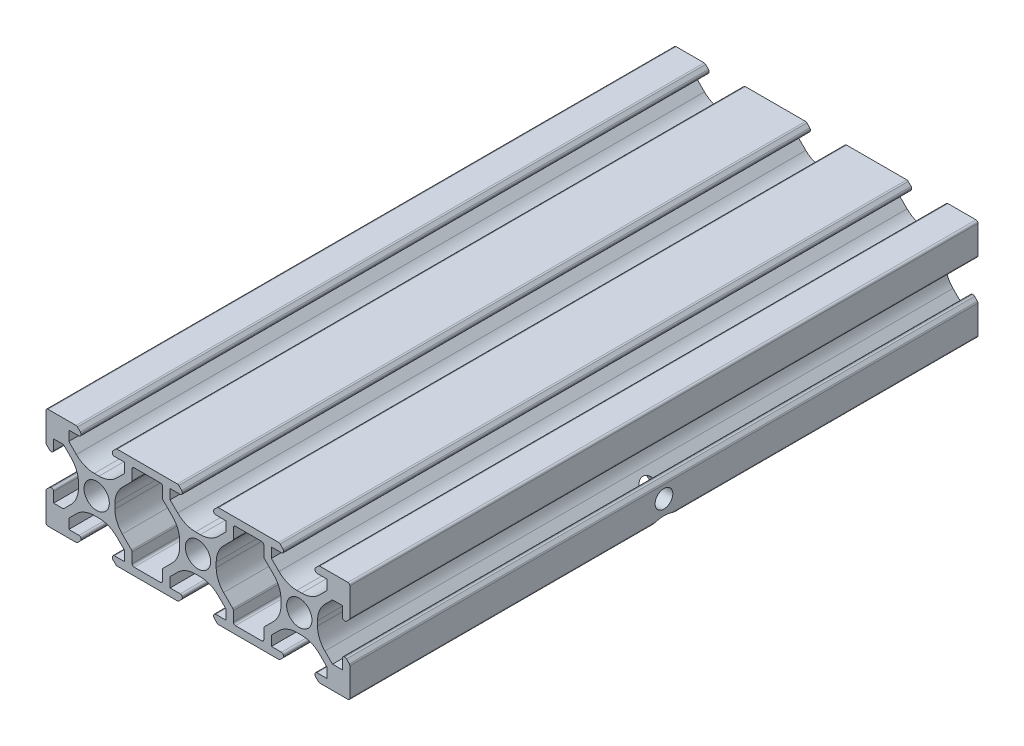
from build123d import *

# Parameters (mm, degrees)
RESSALTO_EXTRUS_O1_DEPTH    = 124
PADR_OCIRCULAR1_COUNT       = 4
PADR_O_LINEAR1_COUNT        = 3
PADR_O_LINEAR1_PITCH        = 20
PADR_O_LINEAR1_COPY_1_DEPTH = 124
PADR_O_LINEAR1_COPY_2_DEPTH = 124
PADR_O_LINEAR1_COPY_3_DEPTH = 124
PADR_O_LINEAR1_COPY_4_DEPTH = 124
PADR_O_LINEAR1_COPY_5_DEPTH = 124
PADR_O_LINEAR1_COPY_6_DEPTH = 124
CORTE_EXTRUS_O1_DEPTH       = 135.074606097
PADR_O_LINEAR2_COUNT        = 2
PADR_O_LINEAR2_PITCH        = 20
FILETE1_R                   = 0.4
FILETE2_R                   = 0.4
SKETCH2_R                   = 5.1
CUT_EXTRUDE2_DEPTH          = 139.115893365
SKETCH3_R                   = 1.75
CUT_EXTRUDE3_DEPTH          = 139.115893505


with BuildPart() as part:
    # Esboço1 → Ressalto-extrusão1 (new body)
    with BuildSketch(Plane.XY):
        with BuildLine():
            ThreePointArc((-9.317157288, 3.217157288), (-9.187387948, 3.130448187), (-9.034314575, 3.1))
            Line((-9.034314575, 3.1), (-8.9, 3.1))
            ThreePointArc((-8.9, 3.1), (-8.617157288, 3.217157288), (-8.5, 3.5))
            Line((-8.5, 3.5), (-8.5, 5.5))
            Line((-8.5, 5.5), (-6.560660172, 5.5))
            Line((-6.560660172, 5.5), (-5.064466094, 4.003805922))
            ThreePointArc((-5.064466094, 4.003805922), (-3.980602337, 2.381689178), (-3.6, 0.468272016))
            Line((-3.6, 0.468272016), (-3.6, 0))
            Line((-3.6, 0), (-2.5, 0))
            ThreePointArc((-2.5, 0), (-1.767766953, 1.767766953), (0, 2.5))
            Line((0, 2.5), (0, 3.6))
            Line((0, 3.6), (-0.468272016, 3.6))
            ThreePointArc((-0.468272016, 3.6), (-2.381689178, 3.980602337), (-4.003805922, 5.064466094))
            Line((-4.003805922, 5.064466094), (-5.5, 6.560660172))
            Line((-5.5, 6.560660172), (-5.5, 8.5))
            Line((-5.5, 8.5), (-3.5, 8.5))
            ThreePointArc((-3.5, 8.5), (-3.217157288, 8.617157288), (-3.1, 8.9))
            Line((-3.1, 8.9), (-3.1, 9.034314575))
            ThreePointArc((-3.1, 9.034314575), (-3.130448187, 9.187387948), (-3.217157288, 9.317157288))
            Line((-3.217157288, 9.317157288), (-3.782842712, 9.882842712))
            ThreePointArc((-3.782842712, 9.882842712), (-3.912612052, 9.969551813), (-4.065685425, 10))
            Line((-4.065685425, 10), (-10, 10))
            Line((-10, 10), (-10, 4.065685425))
            ThreePointArc((-10, 4.065685425), (-9.969551813, 3.912612052), (-9.882842712, 3.782842712))
            Line((-9.882842712, 3.782842712), (-9.317157288, 3.217157288))
        make_face()
    ressalto_extrus_o1 = extrude(amount=RESSALTO_EXTRUS_O1_DEPTH)

    # PadrãoCircular1: Ressalto-extrusão1 ×4 about axis
    padr_ocircular1_axis = Axis((0, 0, 0), (0, 0, 1))
    for i in range(1, PADR_OCIRCULAR1_COUNT):
        add(ressalto_extrus_o1.rotate(padr_ocircular1_axis, i * 360 / PADR_OCIRCULAR1_COUNT))

    # Padrão linear1: Ressalto-extrusão1 ×3
    with Locations(*[(i * PADR_O_LINEAR1_PITCH, 0, 0) for i in range(1, PADR_O_LINEAR1_COUNT)]):
        add(ressalto_extrus_o1)

    # Padrão linear1 copy 1 sketch → Padrão linear1 copy 1 (add)
    with BuildSketch(Plane(origin=(20, 0, 0), x_dir=(0, 1, 0), z_dir=(0, 0, 1))):
        with BuildLine():
            ThreePointArc((-9.317157288, 3.217157288), (-9.187387948, 3.130448187), (-9.034314575, 3.1))
            Line((-9.034314575, 3.1), (-8.9, 3.1))
            ThreePointArc((-8.9, 3.1), (-8.617157288, 3.217157288), (-8.5, 3.5))
            Line((-8.5, 3.5), (-8.5, 5.5))
            Line((-8.5, 5.5), (-6.560660172, 5.5))
            Line((-6.560660172, 5.5), (-5.064466094, 4.003805922))
            ThreePointArc((-5.064466094, 4.003805922), (-3.980602337, 2.381689178), (-3.6, 0.468272016))
            Line((-3.6, 0.468272016), (-3.6, 0))
            Line((-3.6, 0), (-2.5, 0))
            ThreePointArc((-2.5, 0), (-1.767766953, 1.767766953), (0, 2.5))
            Line((0, 2.5), (0, 3.6))
            Line((0, 3.6), (-0.468272016, 3.6))
            ThreePointArc((-0.468272016, 3.6), (-2.381689178, 3.980602337), (-4.003805922, 5.064466094))
            Line((-4.003805922, 5.064466094), (-5.5, 6.560660172))
            Line((-5.5, 6.560660172), (-5.5, 8.5))
            Line((-5.5, 8.5), (-3.5, 8.5))
            ThreePointArc((-3.5, 8.5), (-3.217157288, 8.617157288), (-3.1, 8.9))
            Line((-3.1, 8.9), (-3.1, 9.034314575))
            ThreePointArc((-3.1, 9.034314575), (-3.130448187, 9.187387948), (-3.217157288, 9.317157288))
            Line((-3.217157288, 9.317157288), (-3.782842712, 9.882842712))
            ThreePointArc((-3.782842712, 9.882842712), (-3.912612052, 9.969551813), (-4.065685425, 10))
            Line((-4.065685425, 10), (-10, 10))
            Line((-10, 10), (-10, 4.065685425))
            ThreePointArc((-10, 4.065685425), (-9.969551813, 3.912612052), (-9.882842712, 3.782842712))
            Line((-9.882842712, 3.782842712), (-9.317157288, 3.217157288))
        make_face()
    extrude(amount=PADR_O_LINEAR1_COPY_1_DEPTH)

    # Padrão linear1 copy 2 sketch → Padrão linear1 copy 2 (add)
    with BuildSketch(Plane(origin=(40, 0, 0), x_dir=(0, 1, 0), z_dir=(0, 0, 1))):
        with BuildLine():
            ThreePointArc((-9.317157288, 3.217157288), (-9.187387948, 3.130448187), (-9.034314575, 3.1))
            Line((-9.034314575, 3.1), (-8.9, 3.1))
            ThreePointArc((-8.9, 3.1), (-8.617157288, 3.217157288), (-8.5, 3.5))
            Line((-8.5, 3.5), (-8.5, 5.5))
            Line((-8.5, 5.5), (-6.560660172, 5.5))
            Line((-6.560660172, 5.5), (-5.064466094, 4.003805922))
            ThreePointArc((-5.064466094, 4.003805922), (-3.980602337, 2.381689178), (-3.6, 0.468272016))
            Line((-3.6, 0.468272016), (-3.6, 0))
            Line((-3.6, 0), (-2.5, 0))
            ThreePointArc((-2.5, 0), (-1.767766953, 1.767766953), (0, 2.5))
            Line((0, 2.5), (0, 3.6))
            Line((0, 3.6), (-0.468272016, 3.6))
            ThreePointArc((-0.468272016, 3.6), (-2.381689178, 3.980602337), (-4.003805922, 5.064466094))
            Line((-4.003805922, 5.064466094), (-5.5, 6.560660172))
            Line((-5.5, 6.560660172), (-5.5, 8.5))
            Line((-5.5, 8.5), (-3.5, 8.5))
            ThreePointArc((-3.5, 8.5), (-3.217157288, 8.617157288), (-3.1, 8.9))
            Line((-3.1, 8.9), (-3.1, 9.034314575))
            ThreePointArc((-3.1, 9.034314575), (-3.130448187, 9.187387948), (-3.217157288, 9.317157288))
            Line((-3.217157288, 9.317157288), (-3.782842712, 9.882842712))
            ThreePointArc((-3.782842712, 9.882842712), (-3.912612052, 9.969551813), (-4.065685425, 10))
            Line((-4.065685425, 10), (-10, 10))
            Line((-10, 10), (-10, 4.065685425))
            ThreePointArc((-10, 4.065685425), (-9.969551813, 3.912612052), (-9.882842712, 3.782842712))
            Line((-9.882842712, 3.782842712), (-9.317157288, 3.217157288))
        make_face()
    extrude(amount=PADR_O_LINEAR1_COPY_2_DEPTH)

    # Padrão linear1 copy 3 sketch → Padrão linear1 copy 3 (add)
    with BuildSketch(Plane(origin=(20, 0, 0), x_dir=(-1, 0, 0), z_dir=(0, 0, 1))):
        with BuildLine():
            ThreePointArc((-9.317157288, 3.217157288), (-9.187387948, 3.130448187), (-9.034314575, 3.1))
            Line((-9.034314575, 3.1), (-8.9, 3.1))
            ThreePointArc((-8.9, 3.1), (-8.617157288, 3.217157288), (-8.5, 3.5))
            Line((-8.5, 3.5), (-8.5, 5.5))
            Line((-8.5, 5.5), (-6.560660172, 5.5))
            Line((-6.560660172, 5.5), (-5.064466094, 4.003805922))
            ThreePointArc((-5.064466094, 4.003805922), (-3.980602337, 2.381689178), (-3.6, 0.468272016))
            Line((-3.6, 0.468272016), (-3.6, 0))
            Line((-3.6, 0), (-2.5, 0))
            ThreePointArc((-2.5, 0), (-1.767766953, 1.767766953), (0, 2.5))
            Line((0, 2.5), (0, 3.6))
            Line((0, 3.6), (-0.468272016, 3.6))
            ThreePointArc((-0.468272016, 3.6), (-2.381689178, 3.980602337), (-4.003805922, 5.064466094))
            Line((-4.003805922, 5.064466094), (-5.5, 6.560660172))
            Line((-5.5, 6.560660172), (-5.5, 8.5))
            Line((-5.5, 8.5), (-3.5, 8.5))
            ThreePointArc((-3.5, 8.5), (-3.217157288, 8.617157288), (-3.1, 8.9))
            Line((-3.1, 8.9), (-3.1, 9.034314575))
            ThreePointArc((-3.1, 9.034314575), (-3.130448187, 9.187387948), (-3.217157288, 9.317157288))
            Line((-3.217157288, 9.317157288), (-3.782842712, 9.882842712))
            ThreePointArc((-3.782842712, 9.882842712), (-3.912612052, 9.969551813), (-4.065685425, 10))
            Line((-4.065685425, 10), (-10, 10))
            Line((-10, 10), (-10, 4.065685425))
            ThreePointArc((-10, 4.065685425), (-9.969551813, 3.912612052), (-9.882842712, 3.782842712))
            Line((-9.882842712, 3.782842712), (-9.317157288, 3.217157288))
        make_face()
    extrude(amount=PADR_O_LINEAR1_COPY_3_DEPTH)

    # Padrão linear1 copy 4 sketch → Padrão linear1 copy 4 (add)
    with BuildSketch(Plane(origin=(40, 0, 0), x_dir=(-1, 0, 0), z_dir=(0, 0, 1))):
        with BuildLine():
            ThreePointArc((-9.317157288, 3.217157288), (-9.187387948, 3.130448187), (-9.034314575, 3.1))
            Line((-9.034314575, 3.1), (-8.9, 3.1))
            ThreePointArc((-8.9, 3.1), (-8.617157288, 3.217157288), (-8.5, 3.5))
            Line((-8.5, 3.5), (-8.5, 5.5))
            Line((-8.5, 5.5), (-6.560660172, 5.5))
            Line((-6.560660172, 5.5), (-5.064466094, 4.003805922))
            ThreePointArc((-5.064466094, 4.003805922), (-3.980602337, 2.381689178), (-3.6, 0.468272016))
            Line((-3.6, 0.468272016), (-3.6, 0))
            Line((-3.6, 0), (-2.5, 0))
            ThreePointArc((-2.5, 0), (-1.767766953, 1.767766953), (0, 2.5))
            Line((0, 2.5), (0, 3.6))
            Line((0, 3.6), (-0.468272016, 3.6))
            ThreePointArc((-0.468272016, 3.6), (-2.381689178, 3.980602337), (-4.003805922, 5.064466094))
            Line((-4.003805922, 5.064466094), (-5.5, 6.560660172))
            Line((-5.5, 6.560660172), (-5.5, 8.5))
            Line((-5.5, 8.5), (-3.5, 8.5))
            ThreePointArc((-3.5, 8.5), (-3.217157288, 8.617157288), (-3.1, 8.9))
            Line((-3.1, 8.9), (-3.1, 9.034314575))
            ThreePointArc((-3.1, 9.034314575), (-3.130448187, 9.187387948), (-3.217157288, 9.317157288))
            Line((-3.217157288, 9.317157288), (-3.782842712, 9.882842712))
            ThreePointArc((-3.782842712, 9.882842712), (-3.912612052, 9.969551813), (-4.065685425, 10))
            Line((-4.065685425, 10), (-10, 10))
            Line((-10, 10), (-10, 4.065685425))
            ThreePointArc((-10, 4.065685425), (-9.969551813, 3.912612052), (-9.882842712, 3.782842712))
            Line((-9.882842712, 3.782842712), (-9.317157288, 3.217157288))
        make_face()
    extrude(amount=PADR_O_LINEAR1_COPY_4_DEPTH)

    # Padrão linear1 copy 5 sketch → Padrão linear1 copy 5 (add)
    with BuildSketch(Plane(origin=(20, 0, 0), x_dir=(0, -1, 0), z_dir=(0, 0, 1))):
        with BuildLine():
            ThreePointArc((-9.317157288, 3.217157288), (-9.187387948, 3.130448187), (-9.034314575, 3.1))
            Line((-9.034314575, 3.1), (-8.9, 3.1))
            ThreePointArc((-8.9, 3.1), (-8.617157288, 3.217157288), (-8.5, 3.5))
            Line((-8.5, 3.5), (-8.5, 5.5))
            Line((-8.5, 5.5), (-6.560660172, 5.5))
            Line((-6.560660172, 5.5), (-5.064466094, 4.003805922))
            ThreePointArc((-5.064466094, 4.003805922), (-3.980602337, 2.381689178), (-3.6, 0.468272016))
            Line((-3.6, 0.468272016), (-3.6, 0))
            Line((-3.6, 0), (-2.5, 0))
            ThreePointArc((-2.5, 0), (-1.767766953, 1.767766953), (0, 2.5))
            Line((0, 2.5), (0, 3.6))
            Line((0, 3.6), (-0.468272016, 3.6))
            ThreePointArc((-0.468272016, 3.6), (-2.381689178, 3.980602337), (-4.003805922, 5.064466094))
            Line((-4.003805922, 5.064466094), (-5.5, 6.560660172))
            Line((-5.5, 6.560660172), (-5.5, 8.5))
            Line((-5.5, 8.5), (-3.5, 8.5))
            ThreePointArc((-3.5, 8.5), (-3.217157288, 8.617157288), (-3.1, 8.9))
            Line((-3.1, 8.9), (-3.1, 9.034314575))
            ThreePointArc((-3.1, 9.034314575), (-3.130448187, 9.187387948), (-3.217157288, 9.317157288))
            Line((-3.217157288, 9.317157288), (-3.782842712, 9.882842712))
            ThreePointArc((-3.782842712, 9.882842712), (-3.912612052, 9.969551813), (-4.065685425, 10))
            Line((-4.065685425, 10), (-10, 10))
            Line((-10, 10), (-10, 4.065685425))
            ThreePointArc((-10, 4.065685425), (-9.969551813, 3.912612052), (-9.882842712, 3.782842712))
            Line((-9.882842712, 3.782842712), (-9.317157288, 3.217157288))
        make_face()
    extrude(amount=PADR_O_LINEAR1_COPY_5_DEPTH)

    # Padrão linear1 copy 6 sketch → Padrão linear1 copy 6 (add)
    with BuildSketch(Plane(origin=(40, 0, 0), x_dir=(0, -1, 0), z_dir=(0, 0, 1))):
        with BuildLine():
            ThreePointArc((-9.317157288, 3.217157288), (-9.187387948, 3.130448187), (-9.034314575, 3.1))
            Line((-9.034314575, 3.1), (-8.9, 3.1))
            ThreePointArc((-8.9, 3.1), (-8.617157288, 3.217157288), (-8.5, 3.5))
            Line((-8.5, 3.5), (-8.5, 5.5))
            Line((-8.5, 5.5), (-6.560660172, 5.5))
            Line((-6.560660172, 5.5), (-5.064466094, 4.003805922))
            ThreePointArc((-5.064466094, 4.003805922), (-3.980602337, 2.381689178), (-3.6, 0.468272016))
            Line((-3.6, 0.468272016), (-3.6, 0))
            Line((-3.6, 0), (-2.5, 0))
            ThreePointArc((-2.5, 0), (-1.767766953, 1.767766953), (0, 2.5))
            Line((0, 2.5), (0, 3.6))
            Line((0, 3.6), (-0.468272016, 3.6))
            ThreePointArc((-0.468272016, 3.6), (-2.381689178, 3.980602337), (-4.003805922, 5.064466094))
            Line((-4.003805922, 5.064466094), (-5.5, 6.560660172))
            Line((-5.5, 6.560660172), (-5.5, 8.5))
            Line((-5.5, 8.5), (-3.5, 8.5))
            ThreePointArc((-3.5, 8.5), (-3.217157288, 8.617157288), (-3.1, 8.9))
            Line((-3.1, 8.9), (-3.1, 9.034314575))
            ThreePointArc((-3.1, 9.034314575), (-3.130448187, 9.187387948), (-3.217157288, 9.317157288))
            Line((-3.217157288, 9.317157288), (-3.782842712, 9.882842712))
            ThreePointArc((-3.782842712, 9.882842712), (-3.912612052, 9.969551813), (-4.065685425, 10))
            Line((-4.065685425, 10), (-10, 10))
            Line((-10, 10), (-10, 4.065685425))
            ThreePointArc((-10, 4.065685425), (-9.969551813, 3.912612052), (-9.882842712, 3.782842712))
            Line((-9.882842712, 3.782842712), (-9.317157288, 3.217157288))
        make_face()
    extrude(amount=PADR_O_LINEAR1_COPY_6_DEPTH)

    # Esboço4 → Corte-extrusão1 (cut, through all)
    with BuildSketch(Plane(origin=(0, 0, 0), x_dir=(-1, 0, 0), z_dir=(0, 0, -1))):
        Polygon((-13.439339828, 5.5), (-13, 5.939339828), (-13, 8.5), (-7, 8.5), (-7, 5.939339828), (-6.560660172, 5.5), (-6.560660172, -5.5), (-7, -5.939339828), (-7, -8.5), (-13, -8.5), (-13, -5.939339828), (-13.439339828, -5.5), align=None)
    corte_extrus_o1 = extrude(amount=-CORTE_EXTRUS_O1_DEPTH, mode=Mode.SUBTRACT)

    # Padrão linear2: Corte-extrusão1 ×2
    with Locations(*[(i * PADR_O_LINEAR2_PITCH, 0, 0) for i in range(1, PADR_O_LINEAR2_COUNT)]):
        add(corte_extrus_o1, mode=Mode.SUBTRACT)

    # Filete1
    filete1_edges = [part.edges().sort_by_distance(p)[0] for p in [
        (13, 5.939339828, 62),
        (13, 8.5, 62),
        (7, 8.5, 62),
        (7, 5.939339828, 62),
        (7, -5.939339828, 62),
        (7, -8.5, 62),
        (13, -8.5, 62),
        (13, -5.939339828, 62),
        (33, 5.939339828, 62),
        (33, 8.5, 62),
        (27, 8.5, 62),
        (27, 5.939339828, 62),
        (27, -5.939339828, 62),
        (27, -8.5, 62),
        (33, -8.5, 62),
        (33, -5.939339828, 62),
    ]]
    fillet(filete1_edges, radius=FILETE1_R)

    # Filete2
    filete2_edges = [part.edges().sort_by_distance(p)[0] for p in [
        (-10, 10, 62),
        (50, -10, 62),
        (50, 10, 62),
        (-10, -10, 62),
    ]]
    fillet(filete2_edges, radius=FILETE2_R)

    # Sketch2 → Cut-Extrude2 (cut, through all)
    with BuildSketch(Plane(origin=(50, 0, 0), x_dir=(0, 0, -1), z_dir=(1, 0, 0))):
        with Locations((-62, -14.5)):
            Circle(SKETCH2_R)
    extrude(amount=-CUT_EXTRUDE2_DEPTH, mode=Mode.SUBTRACT)

    # Sketch3 → Cut-Extrude3 (cut, through all)
    with BuildSketch(Plane(origin=(50, 0, 0), x_dir=(0, 0, -1), z_dir=(1, 0, 0))):
        with Locations(Location((-62, -6.5, 0), (0, 0, 358.013561029))):
            Circle(SKETCH3_R)
    extrude(amount=-CUT_EXTRUDE3_DEPTH, mode=Mode.SUBTRACT)


solid = part.part
